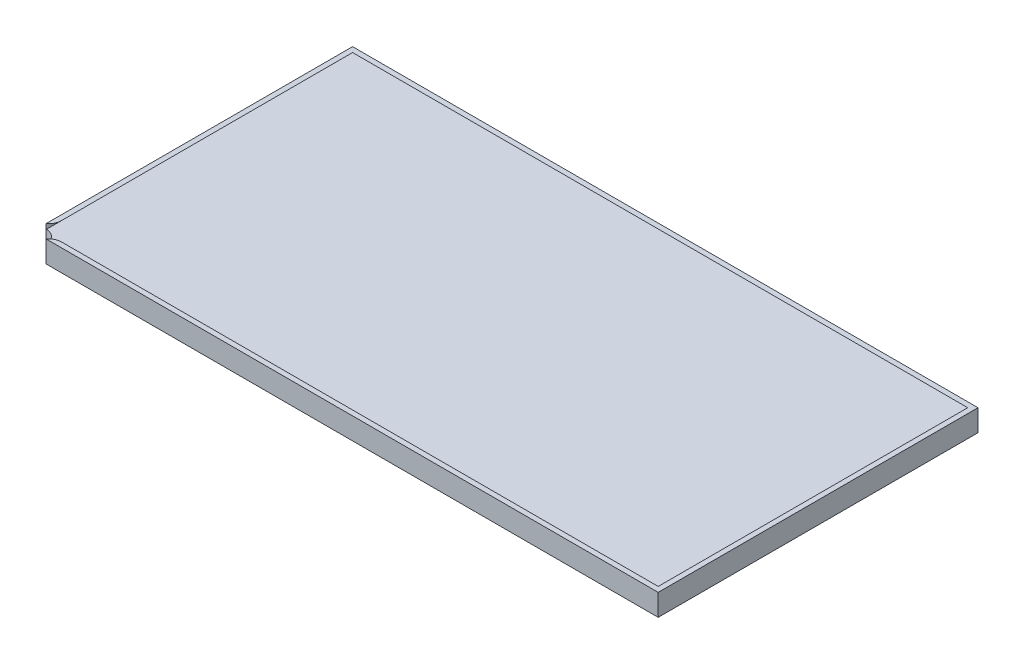
from build123d import *

# Parameters (mm, degrees)
SZKIC4_W                    = 3665
SZKIC4_H                    = 1874
SZKIC4_W_2                  = 3569
SZKIC4_H_2                  = 1778
DODANIE_WYCI_GNI_CIE3_DEPTH = 27
SZKIC5_W                    = 3665
SZKIC5_H                    = 1874
DODANIE_WYCI_GNI_CIE4_DEPTH = 100
WYTNIJ_WYCI_GNI_CIE1_DEPTH  = 27
WYTNIJ_WYCI_GNI_CIE2_REACH  = 2062.589
SZKIC7_R                    = 77.40297037


with BuildPart() as part:
    # Szkic4 → Dodanie-wyciągnięcie3 (new body)
    with BuildSketch(Plane(origin=(0, 0, 0), x_dir=(1, 0, 0), z_dir=(0, 1, 0))):
        Rectangle(SZKIC4_W, SZKIC4_H)
        Rectangle(SZKIC4_W_2, SZKIC4_H_2, mode=Mode.SUBTRACT)
    extrude(amount=DODANIE_WYCI_GNI_CIE3_DEPTH)

    # Sfazowanie1
    # the kernel refuses this chamfer: 45 mm, written as the material it takes off along each edge
    with BuildSketch(Plane(origin=(-1784.5, 0, 889), x_dir=(0, 0.9996219169112966, -0.027495876610587087), z_dir=(1, 0, 0)), Plane(origin=(1784.5, 0, -889), x_dir=(0, 0.9996219169112966, 0.027495876610587087), z_dir=(-1, 0, 0))) as sfazowanie1_piece_1:
        with BuildLine():
            Line((46.290293783, 0), (-2.54462197, 46.220300708))
            Line((-2.54462197, 46.220300708), (-3.444281695, 46.19555442))
            ThreePointArc((-3.444281695, 46.19555442), (-1.535815218, 23.102902334), (-0.899659725, -0.024746289))
            Line((-0.899659725, -0.024746289), (0.024746289, -0.899659725))
            ThreePointArc((0.024746289, -0.899659725), (23.152394912, -0.263504233), (46.315040072, -0.899659725))
            Line((46.315040072, -0.899659725), (46.290293783, 0))
        make_face()
    extrude(amount=3569, mode=Mode.SUBTRACT)
    with BuildSketch(Plane(origin=(-1784.5, 0, -889), x_dir=(0.027495876610587087, 0.9996219169112966, 0), z_dir=(0, 0, 1)), Plane(origin=(1784.5, 0, 889), x_dir=(-0.027495876610587087, 0.9996219169112966, 0), z_dir=(0, 0, -1))) as sfazowanie1_piece_2:
        with BuildLine():
            Line((46.290293783, 0), (-2.54462197, 46.220300708))
            Line((-2.54462197, 46.220300708), (-3.444281695, 46.19555442))
            ThreePointArc((-3.444281695, 46.19555442), (-1.535815218, 23.102902334), (-0.899659725, -0.024746289))
            Line((-0.899659725, -0.024746289), (0.024746289, -0.899659725))
            ThreePointArc((0.024746289, -0.899659725), (23.152394912, -0.263504233), (46.315040072, -0.899659725))
            Line((46.315040072, -0.899659725), (46.290293783, 0))
        make_face()
    extrude(amount=1778, mode=Mode.SUBTRACT)
    with BuildSketch(Plane(origin=(-1784.5, 0, -889), x_dir=(0.027495876610587087, 0.9996219169112966, 0), z_dir=(0, 0, 1))) as sfazowanie1_piece_3a_section:
        with BuildLine():
            Line((46.290293783, 0), (-2.54462197, 46.220300708))
            Line((-2.54462197, 46.220300708), (-3.444281695, 46.19555442))
            ThreePointArc((-3.444281695, 46.19555442), (-1.535815218, 23.102902334), (-0.899659725, -0.024746289))
            Line((-0.899659725, -0.024746289), (0.024746289, -0.899659725))
            ThreePointArc((0.024746289, -0.899659725), (23.152394912, -0.263504233), (46.315040072, -0.899659725))
            Line((46.315040072, -0.899659725), (46.290293783, 0))
        make_face()
    sfazowanie1_piece_3a = extrude(amount=1893.725734458, mode=Mode.PRIVATE)
    sfazowanie1_piece_3a = split(sfazowanie1_piece_3a, bisect_by=Plane(origin=(-1799.340713206, 14.840713206, 889), z_dir=(0, 0, 1)), keep=Keep.TOP, mode=Mode.PRIVATE)
    with BuildSketch(Plane(origin=(-1900.225734458, 0, 889), x_dir=(0, 0.9996219169112966, -0.027495876610587087), z_dir=(1, 0, 0))) as sfazowanie1_piece_3b_section:
        with BuildLine():
            Line((46.290293783, 0), (-2.54462197, 46.220300708))
            Line((-2.54462197, 46.220300708), (-3.444281695, 46.19555442))
            ThreePointArc((-3.444281695, 46.19555442), (-1.535815218, 23.102902334), (-0.899659725, -0.024746289))
            Line((-0.899659725, -0.024746289), (0.024746289, -0.899659725))
            ThreePointArc((0.024746289, -0.899659725), (23.152394912, -0.263504233), (46.315040072, -0.899659725))
            Line((46.315040072, -0.899659725), (46.290293783, 0))
        make_face()
    sfazowanie1_piece_3b = extrude(amount=3684.725734458, mode=Mode.PRIVATE)
    sfazowanie1_piece_3b = split(sfazowanie1_piece_3b, bisect_by=Plane(origin=(-1784.5, 14.840713206, 903.840713206), z_dir=(-1, 0, 0)), keep=Keep.TOP, mode=Mode.PRIVATE)
    sfazowanie1_piece_3 = sfazowanie1_piece_3a & sfazowanie1_piece_3b
    add(sfazowanie1_piece_3, mode=Mode.SUBTRACT)
    with BuildSketch(Plane(origin=(1784.5, 0, 1004.725734458), x_dir=(-0.027495876610587087, 0.9996219169112966, 0), z_dir=(0, 0, -1))) as sfazowanie1_piece_4a_section:
        with BuildLine():
            Line((46.290293783, 0), (-2.54462197, 46.220300708))
            Line((-2.54462197, 46.220300708), (-3.444281695, 46.19555442))
            ThreePointArc((-3.444281695, 46.19555442), (-1.535815218, 23.102902334), (-0.899659725, -0.024746289))
            Line((-0.899659725, -0.024746289), (0.024746289, -0.899659725))
            ThreePointArc((0.024746289, -0.899659725), (23.152394912, -0.263504233), (46.315040072, -0.899659725))
            Line((46.315040072, -0.899659725), (46.290293783, 0))
        make_face()
    sfazowanie1_piece_4a = extrude(amount=1893.725734458, mode=Mode.PRIVATE)
    sfazowanie1_piece_4a = split(sfazowanie1_piece_4a, bisect_by=Plane(origin=(1799.340713206, 14.840713206, 889), z_dir=(0, 0, 1)), keep=Keep.TOP, mode=Mode.PRIVATE)
    with BuildSketch(Plane(origin=(-1784.5, 0, 889), x_dir=(0, 0.9996219169112966, -0.027495876610587087), z_dir=(1, 0, 0))) as sfazowanie1_piece_4b_section:
        with BuildLine():
            Line((46.290293783, 0), (-2.54462197, 46.220300708))
            Line((-2.54462197, 46.220300708), (-3.444281695, 46.19555442))
            ThreePointArc((-3.444281695, 46.19555442), (-1.535815218, 23.102902334), (-0.899659725, -0.024746289))
            Line((-0.899659725, -0.024746289), (0.024746289, -0.899659725))
            ThreePointArc((0.024746289, -0.899659725), (23.152394912, -0.263504233), (46.315040072, -0.899659725))
            Line((46.315040072, -0.899659725), (46.290293783, 0))
        make_face()
    sfazowanie1_piece_4b = extrude(amount=3684.725734458, mode=Mode.PRIVATE)
    sfazowanie1_piece_4b = split(sfazowanie1_piece_4b, bisect_by=Plane(origin=(1784.5, 14.840713206, 903.840713206), z_dir=(1, 0, 0)), keep=Keep.TOP, mode=Mode.PRIVATE)
    sfazowanie1_piece_4 = sfazowanie1_piece_4a & sfazowanie1_piece_4b
    add(sfazowanie1_piece_4, mode=Mode.SUBTRACT)
    with BuildSketch(Plane(origin=(-1784.5, 0, -1004.725734458), x_dir=(0.027495876610587087, 0.9996219169112966, 0), z_dir=(0, 0, 1))) as sfazowanie1_piece_5a_section:
        with BuildLine():
            Line((46.290293783, 0), (-2.54462197, 46.220300708))
            Line((-2.54462197, 46.220300708), (-3.444281695, 46.19555442))
            ThreePointArc((-3.444281695, 46.19555442), (-1.535815218, 23.102902334), (-0.899659725, -0.024746289))
            Line((-0.899659725, -0.024746289), (0.024746289, -0.899659725))
            ThreePointArc((0.024746289, -0.899659725), (23.152394912, -0.263504233), (46.315040072, -0.899659725))
            Line((46.315040072, -0.899659725), (46.290293783, 0))
        make_face()
    sfazowanie1_piece_5a = extrude(amount=1893.725734458, mode=Mode.PRIVATE)
    sfazowanie1_piece_5a = split(sfazowanie1_piece_5a, bisect_by=Plane(origin=(-1799.340713206, 14.840713206, -889), z_dir=(0, 0, -1)), keep=Keep.TOP, mode=Mode.PRIVATE)
    with BuildSketch(Plane(origin=(1784.5, 0, -889), x_dir=(0, 0.9996219169112966, 0.027495876610587087), z_dir=(-1, 0, 0))) as sfazowanie1_piece_5b_section:
        with BuildLine():
            Line((46.290293783, 0), (-2.54462197, 46.220300708))
            Line((-2.54462197, 46.220300708), (-3.444281695, 46.19555442))
            ThreePointArc((-3.444281695, 46.19555442), (-1.535815218, 23.102902334), (-0.899659725, -0.024746289))
            Line((-0.899659725, -0.024746289), (0.024746289, -0.899659725))
            ThreePointArc((0.024746289, -0.899659725), (23.152394912, -0.263504233), (46.315040072, -0.899659725))
            Line((46.315040072, -0.899659725), (46.290293783, 0))
        make_face()
    sfazowanie1_piece_5b = extrude(amount=3684.725734458, mode=Mode.PRIVATE)
    sfazowanie1_piece_5b = split(sfazowanie1_piece_5b, bisect_by=Plane(origin=(-1784.5, 14.840713206, -903.840713206), z_dir=(-1, 0, 0)), keep=Keep.TOP, mode=Mode.PRIVATE)
    sfazowanie1_piece_5 = sfazowanie1_piece_5a & sfazowanie1_piece_5b
    add(sfazowanie1_piece_5, mode=Mode.SUBTRACT)
    with BuildSketch(Plane(origin=(1900.225734458, 0, -889), x_dir=(0, 0.9996219169112966, 0.027495876610587087), z_dir=(-1, 0, 0))) as sfazowanie1_piece_6a_section:
        with BuildLine():
            Line((46.290293783, 0), (-2.54462197, 46.220300708))
            Line((-2.54462197, 46.220300708), (-3.444281695, 46.19555442))
            ThreePointArc((-3.444281695, 46.19555442), (-1.535815218, 23.102902334), (-0.899659725, -0.024746289))
            Line((-0.899659725, -0.024746289), (0.024746289, -0.899659725))
            ThreePointArc((0.024746289, -0.899659725), (23.152394912, -0.263504233), (46.315040072, -0.899659725))
            Line((46.315040072, -0.899659725), (46.290293783, 0))
        make_face()
    sfazowanie1_piece_6a = extrude(amount=3684.725734458, mode=Mode.PRIVATE)
    sfazowanie1_piece_6a = split(sfazowanie1_piece_6a, bisect_by=Plane(origin=(1784.5, 14.840713206, -903.840713206), z_dir=(1, 0, 0)), keep=Keep.TOP, mode=Mode.PRIVATE)
    with BuildSketch(Plane(origin=(1784.5, 0, 889), x_dir=(-0.027495876610587087, 0.9996219169112966, 0), z_dir=(0, 0, -1))) as sfazowanie1_piece_6b_section:
        with BuildLine():
            Line((46.290293783, 0), (-2.54462197, 46.220300708))
            Line((-2.54462197, 46.220300708), (-3.444281695, 46.19555442))
            ThreePointArc((-3.444281695, 46.19555442), (-1.535815218, 23.102902334), (-0.899659725, -0.024746289))
            Line((-0.899659725, -0.024746289), (0.024746289, -0.899659725))
            ThreePointArc((0.024746289, -0.899659725), (23.152394912, -0.263504233), (46.315040072, -0.899659725))
            Line((46.315040072, -0.899659725), (46.290293783, 0))
        make_face()
    sfazowanie1_piece_6b = extrude(amount=1893.725734458, mode=Mode.PRIVATE)
    sfazowanie1_piece_6b = split(sfazowanie1_piece_6b, bisect_by=Plane(origin=(1799.340713206, 14.840713206, -889), z_dir=(0, 0, -1)), keep=Keep.TOP, mode=Mode.PRIVATE)
    sfazowanie1_piece_6 = sfazowanie1_piece_6a & sfazowanie1_piece_6b
    add(sfazowanie1_piece_6, mode=Mode.SUBTRACT)

    # Szkic5 → Dodanie-wyciągnięcie4 (add)
    with BuildSketch(Plane.XZ):
        Rectangle(SZKIC5_W, SZKIC5_H)
    extrude(amount=DODANIE_WYCI_GNI_CIE4_DEPTH)

    # Szkic6 → Wytnij-wyciągnięcie1 (cut)
    with BuildSketch(Plane(origin=(0, 27, 0), x_dir=(1, 0, 0), z_dir=(0, 1, 0))):
        with BuildLine():
            Line((-1832.5, -859.59702963), (-1832.5, -937))
            Line((-1832.5, -937), (-1755.09702963, -937))
            ThreePointArc((-1755.09702963, -937), (-1728.308283009, -914.910615759), (-1694.5, -907))
            Line((-1694.5, -907), (-1802.5, -907))
            Line((-1802.5, -907), (-1802.5, -799))
            ThreePointArc((-1802.5, -799), (-1810.410615759, -832.808283009), (-1832.5, -859.59702963))
        make_face()
    extrude(amount=-WYTNIJ_WYCI_GNI_CIE1_DEPTH, mode=Mode.SUBTRACT)

    # Szkic7 → Wytnij-wyciągnięcie2 (cut, up to next)
    with BuildSketch(Plane(origin=(0, 0, 0), x_dir=(1, 0, 0), z_dir=(0, 1, 0)), mode=Mode.PRIVATE) as wytnij_wyci_gni_cie2_sk1:
        with Locations((-1832.5, -937)):
            Circle(SZKIC7_R)
    wytnij_wyci_gni_cie2_tool1 = extrude(wytnij_wyci_gni_cie2_sk1.sketch, amount=-WYTNIJ_WYCI_GNI_CIE2_REACH, mode=Mode.PRIVATE) & part.part
    add(wytnij_wyci_gni_cie2_tool1.solids().sort_by_distance((-1832.5, 0, 937))[0], mode=Mode.SUBTRACT)


solid = part.part
